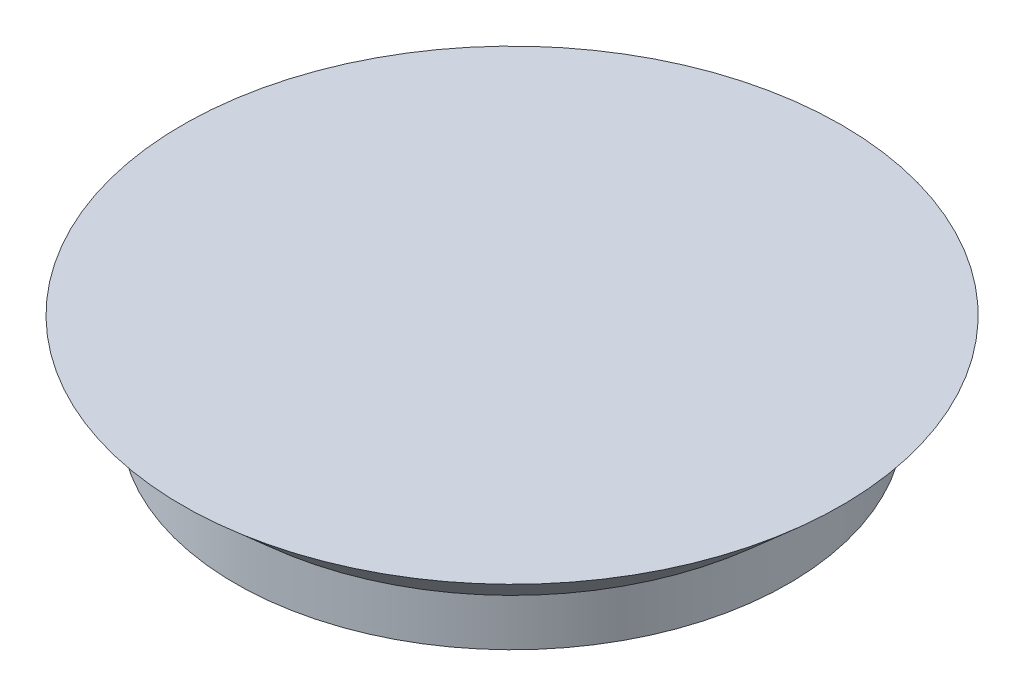
from build123d import *


with BuildPart() as part:
    # Sketch1 → Revolve1 (revolve)
    with BuildSketch(Plane(origin=(0, 0, 0), x_dir=(0, 0, -1), z_dir=(1, 0, 0))):
        Polygon((-14, 2), (0, 2), (0, 0), (0, -2), (-1.5, -2), (-1.5, -7), (-2.5, -7), (-2.5, -2), (-11.75, -2), (-11.75, 0), align=None)
    revolve(axis=Axis((0, -2, 0), (0, 1, 0)))


solid = part.part
